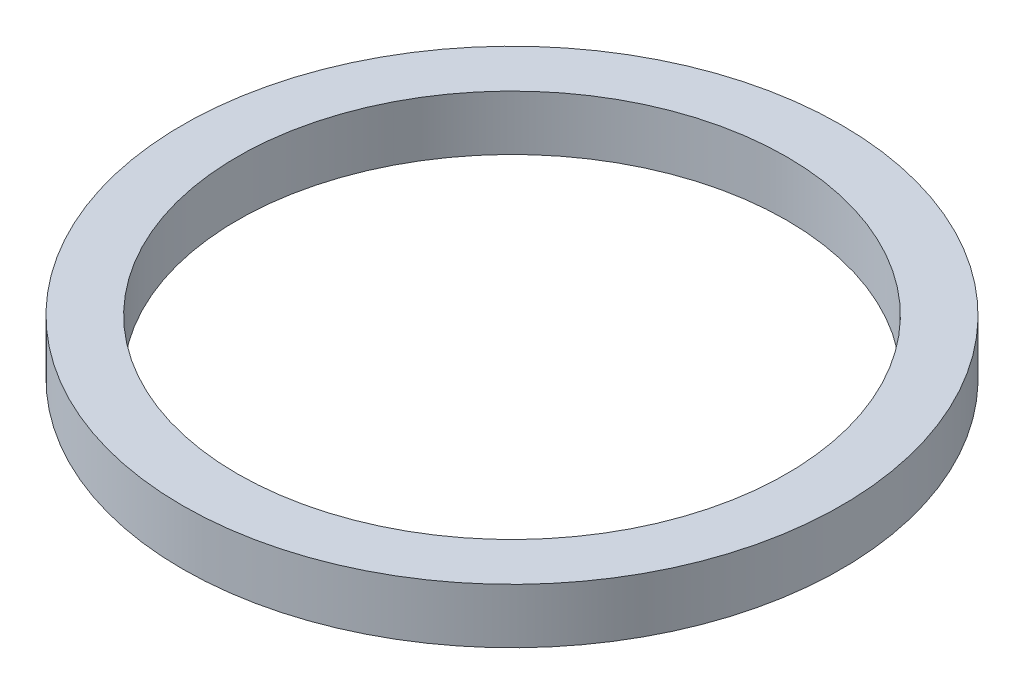
from build123d import *

# Parameters (mm, degrees)
SKETCH1_R           = 6
SKETCH1_R_2         = 5
BOSS_EXTRUDE1_DEPTH = 1


with BuildPart() as part:
    # Sketch1 → Boss-Extrude1 (new body)
    with BuildSketch(Plane(origin=(0, 0, 0), x_dir=(1, 0, 0), z_dir=(0, 1, 0))):
        Circle(SKETCH1_R)
        Circle(SKETCH1_R_2, mode=Mode.SUBTRACT)
    extrude(amount=BOSS_EXTRUDE1_DEPTH)


solid = part.part
